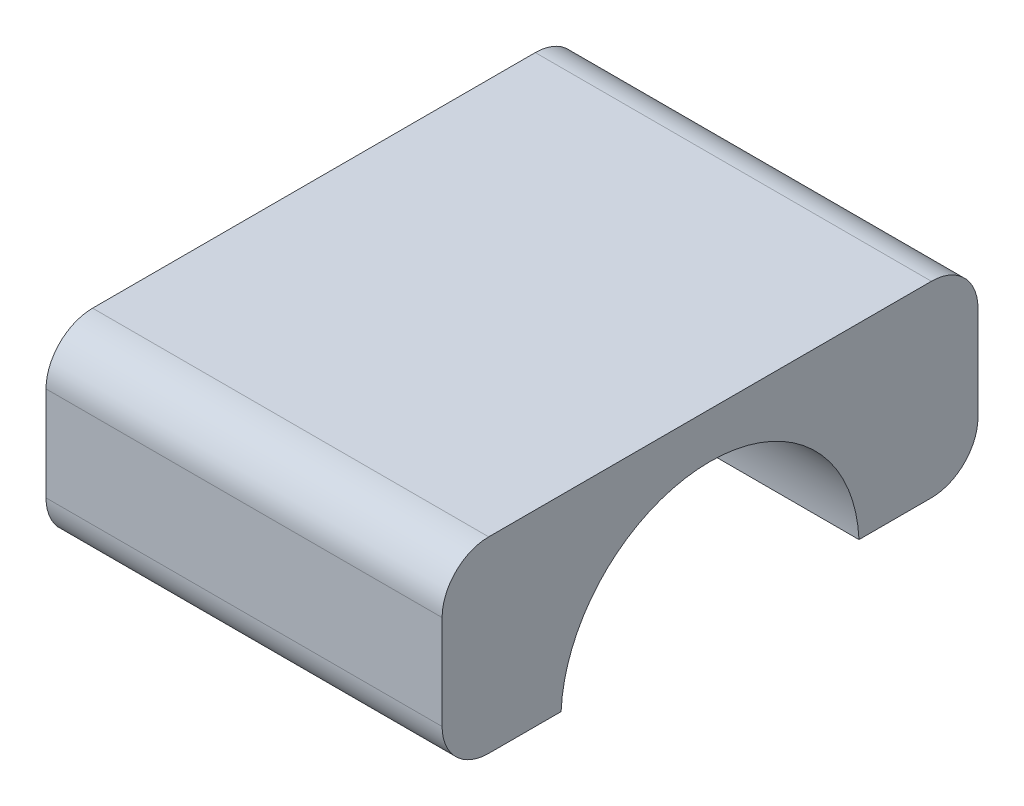
from build123d import *

# Parameters (mm, degrees)
BOSS_EXTRUDE1_DEPTH     = 17
CUT_EXTRUDE1_DEPTH      = 34.119329703
CUT_EXTRUDE1_DEPTH_BACK = 34.119329703
SKETCH2_R               = 12.8
SKETCH3_R               = 2
CUT_EXTRUDE2_DEPTH      = 7.5


with BuildPart() as part:
    # Sketch1 → Boss-Extrude1 (new, symmetric)
    with BuildSketch(Plane(origin=(0, 0, 0), x_dir=(0, 0, -1), z_dir=(1, 0, 0))):
        with BuildLine():
            Line((-19, 0.6), (19, 0.6))
            ThreePointArc((19, 0.6), (21.828427125, 1.771572875), (23, 4.6))
            Line((23, 4.6), (23, 12.7))
            ThreePointArc((23, 12.7), (21.828427125, 15.528427125), (19, 16.7))
            Line((19, 16.7), (-19, 16.7))
            ThreePointArc((-19, 16.7), (-21.828427125, 15.528427125), (-23, 12.7))
            Line((-23, 12.7), (-23, 4.6))
            ThreePointArc((-23, 4.6), (-21.828427125, 1.771572875), (-19, 0.6))
        make_face()
    extrude(amount=BOSS_EXTRUDE1_DEPTH, both=True)

    # Sketch2 → Cut-Extrude1 (cut, two sides: drawn at the far end of the back side and taken through both)
    with BuildSketch(Plane(origin=(0, 0, 0), x_dir=(0, 0, -1), z_dir=(1, 0, 0)).offset(-CUT_EXTRUDE1_DEPTH_BACK)):
        Circle(SKETCH2_R)
    extrude(amount=CUT_EXTRUDE1_DEPTH + CUT_EXTRUDE1_DEPTH_BACK, mode=Mode.SUBTRACT)

    # Sketch3 → Cut-Extrude2 (cut)
    with BuildSketch(Plane(origin=(0, 0.6, 0), x_dir=(1, 0, 0), z_dir=(0, 1, 0))):
        with Locations((12, -17.5)):
            Circle(SKETCH3_R)
        with Locations((12, 17.5)):
            Circle(SKETCH3_R)
        with Locations((-12, -17.5)):
            Circle(SKETCH3_R)
        with Locations((-12, 17.5)):
            Circle(SKETCH3_R)
    extrude(amount=CUT_EXTRUDE2_DEPTH, mode=Mode.SUBTRACT)


solid = part.part
